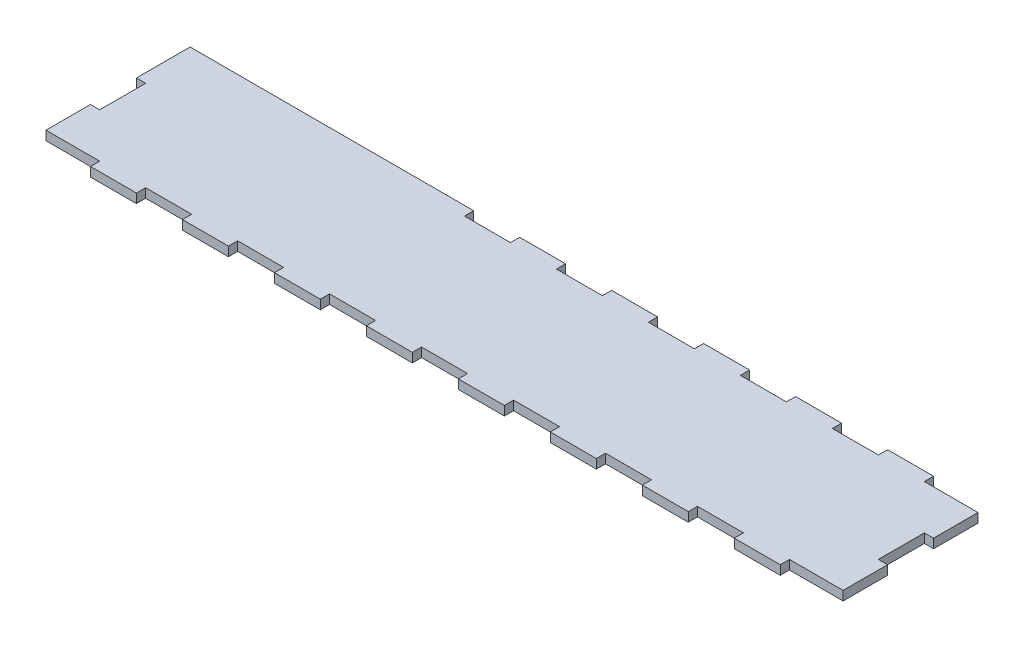
from build123d import *

# Parameters (mm, degrees)
SALIENTE_EXTRUIR1_DEPTH = 3


with BuildPart() as part:
    # Croquis1 → Saliente-Extruir1 (new body)
    with BuildSketch(Plane(origin=(0, 0, 0), x_dir=(1, 0, 0), z_dir=(0, 1, 0))):
        Polygon((17.5, 3), (17.5, 0), (32.5, 0), (32.5, 3), (47.5, 3), (47.5, 0), (62.5, 0), (62.5, 3), (77.5, 3), (77.5, 0), (92.5, 0), (92.5, 3), (107.5, 3), (107.5, 0), (122.5, 0), (122.5, 3), (137.5, 3), (137.5, 0), (152.5, 0), (152.5, 3), (167.5, 3), (167.5, 0), (182.5, 0), (182.5, 3), (197.5, 3), (197.5, 0), (212.5, 0), (212.5, 3), (227.5, 3), (227.5, 0), (242.5, 0), (242.5, 3), (260, 3), (260, 17.5), (257, 17.5), (257, 32.5), (260, 32.5), (260, 47), (242.5, 47), (242.5, 50), (227.5, 50), (227.5, 47), (212.5, 47), (212.5, 50), (197.5, 50), (197.5, 47), (182.5, 47), (182.5, 50), (167.5, 50), (167.5, 47), (152.5, 47), (152.5, 50), (137.5, 50), (137.5, 47), (122.5, 47), (122.5, 50), (107.5, 50), (107.5, 47), (92.5, 47), (92.5, 50), (77.5, 50), (62.5, 50), (47.5, 50), (32.5, 50), (17.5, 50), (0, 50), (0, 47), (0, 32.5), (3, 32.5), (3, 17.5), (0, 17.5), (0, 3), align=None)
    extrude(amount=SALIENTE_EXTRUIR1_DEPTH)


solid = part.part
